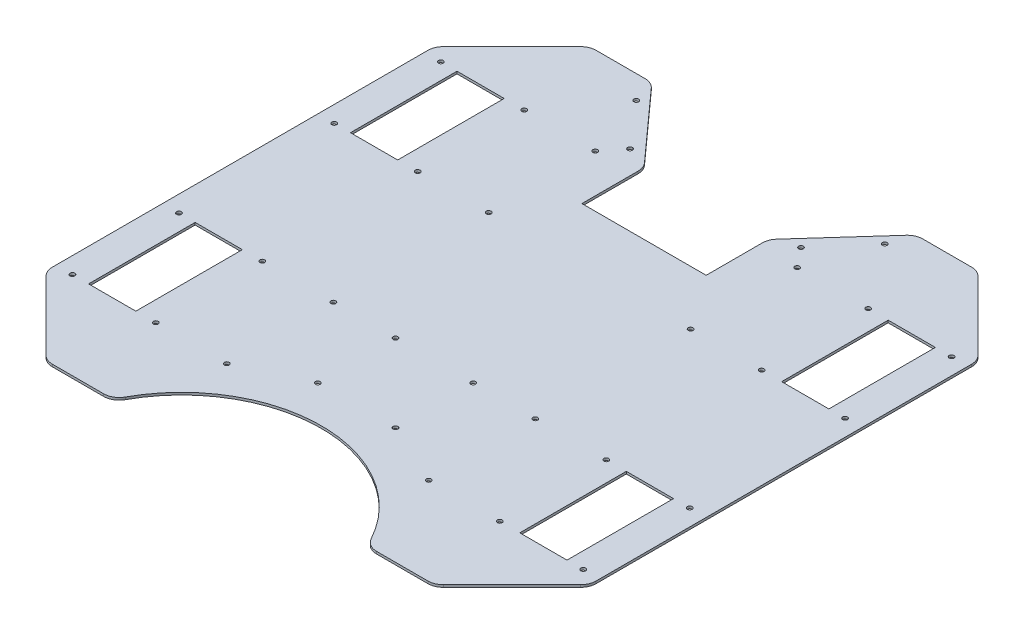
from build123d import *

# Parameters (mm, degrees)
SKETCH_1_R      = 1.55
SKETCH_1_W      = 30.4
SKETCH_1_H      = 68.58
EXTRUDE_1_DEPTH = 1.5
FILLET_1_R      = 10
FILLET_2_R      = 10
FILLET_3_R      = 10


with BuildPart() as part:
    # 草图1 → 凸台-拉伸1 (new body)
    with BuildSketch(Plane(origin=(0, 0, 0), x_dir=(1, 0, 0), z_dir=(0, 1, 0))):
        with BuildLine():
            Line((-125, 175), (-175, 125))
            Line((-175, 125), (-175, -125))
            Line((-175, -125), (-125, -175))
            Line((-125, -175), (-81.710313025, -175))
            ThreePointArc((-81.710313025, -175), (0, -122.728301649), (81.710313025, -175))
            Line((81.710313025, -175), (125, -175))
            Line((125, -175), (175, -125))
            Line((175, -125), (175, 125))
            Line((175, 125), (125, 175))
            Line((125, 175), (85, 175))
            Line((85, 175), (40, 125))
            Line((40, 125), (40, 85))
            Line((40, 85), (-40, 85))
            Line((-40, 85), (-40, 125))
            Line((-40, 125), (-85, 175))
            Line((-85, 175), (-125, 175))
        make_face()
        with Locations((-55, 131)):
            Circle(SKETCH_1_R, mode=Mode.SUBTRACT)
        with Locations((-80, 160)):
            Circle(SKETCH_1_R, mode=Mode.SUBTRACT)
        with Locations((55, 131)):
            Circle(SKETCH_1_R, mode=Mode.SUBTRACT)
        with Locations((80, 160)):
            Circle(SKETCH_1_R, mode=Mode.SUBTRACT)
        with Locations((-65, 118.58)):
            Circle(SKETCH_1_R, mode=Mode.SUBTRACT)
        with Locations((-65, 50)):
            Circle(SKETCH_1_R, mode=Mode.SUBTRACT)
        with Locations((-110.72, 50)):
            Circle(SKETCH_1_R, mode=Mode.SUBTRACT)
        with Locations((-110.72, 118.58)):
            Circle(SKETCH_1_R, mode=Mode.SUBTRACT)
        with Locations((-164.434, 118.58)):
            Circle(SKETCH_1_R, mode=Mode.SUBTRACT)
        with Locations((-164.434, 50)):
            Circle(SKETCH_1_R, mode=Mode.SUBTRACT)
        with Locations((-65, -118.58)):
            Circle(SKETCH_1_R, mode=Mode.SUBTRACT)
        with Locations((-65, -50)):
            Circle(SKETCH_1_R, mode=Mode.SUBTRACT)
        with Locations((-110.72, -50)):
            Circle(SKETCH_1_R, mode=Mode.SUBTRACT)
        with Locations((-110.72, -118.58)):
            Circle(SKETCH_1_R, mode=Mode.SUBTRACT)
        with Locations((-164.434, -50)):
            Circle(SKETCH_1_R, mode=Mode.SUBTRACT)
        with Locations((-164.434, -118.58)):
            Circle(SKETCH_1_R, mode=Mode.SUBTRACT)
        with Locations((65, 50)):
            Circle(SKETCH_1_R, mode=Mode.SUBTRACT)
        with Locations((110.72, 50)):
            Circle(SKETCH_1_R, mode=Mode.SUBTRACT)
        with Locations((110.72, 118.58)):
            Circle(SKETCH_1_R, mode=Mode.SUBTRACT)
        with Locations((65, 118.58)):
            Circle(SKETCH_1_R, mode=Mode.SUBTRACT)
        with Locations((164.434, 118.58)):
            Circle(SKETCH_1_R, mode=Mode.SUBTRACT)
        with Locations((164.434, 50)):
            Circle(SKETCH_1_R, mode=Mode.SUBTRACT)
        with Locations((164.434, -118.58)):
            Circle(SKETCH_1_R, mode=Mode.SUBTRACT)
        with Locations((164.434, -50)):
            Circle(SKETCH_1_R, mode=Mode.SUBTRACT)
        with Locations((110.72, -50)):
            Circle(SKETCH_1_R, mode=Mode.SUBTRACT)
        with Locations((110.72, -118.58)):
            Circle(SKETCH_1_R, mode=Mode.SUBTRACT)
        with Locations((65, -118.58)):
            Circle(SKETCH_1_R, mode=Mode.SUBTRACT)
        with Locations((65, -50)):
            Circle(SKETCH_1_R, mode=Mode.SUBTRACT)
        with Locations((25, -50)):
            Circle(SKETCH_1_R, mode=Mode.SUBTRACT)
        with Locations((25, -100)):
            Circle(SKETCH_1_R, mode=Mode.SUBTRACT)
        with Locations((-25, -50)):
            Circle(SKETCH_1_R, mode=Mode.SUBTRACT)
        with Locations((-25, -100)):
            Circle(SKETCH_1_R, mode=Mode.SUBTRACT)
        with Locations((-138.794, 84.29)):
            Rectangle(SKETCH_1_W, SKETCH_1_H, mode=Mode.SUBTRACT)
        with Locations((138.794, 84.29)):
            Rectangle(SKETCH_1_W, SKETCH_1_H, mode=Mode.SUBTRACT)
        with Locations((-138.794, -84.29)):
            Rectangle(SKETCH_1_W, SKETCH_1_H, mode=Mode.SUBTRACT)
        with Locations((138.794, -84.29)):
            Rectangle(SKETCH_1_W, SKETCH_1_H, mode=Mode.SUBTRACT)
    extrude(amount=EXTRUDE_1_DEPTH)

    # 圆角1
    fillet_1_edges = [part.edges().sort_by_distance(p)[0] for p in [
        (-40, 0.75, -125),
    ]]
    fillet(fillet_1_edges, radius=FILLET_1_R)

    # 圆角2
    fillet_2_edges = [part.edges().sort_by_distance(p)[0] for p in [
        (40, 0.75, -125),
    ]]
    fillet(fillet_2_edges, radius=FILLET_2_R)

    # 圆角3
    fillet_3_edges = [part.edges().sort_by_distance(p)[0] for p in [
        (-85, 0.75, -175),
        (85, 0.75, -175),
        (125, 0.75, -175),
        (175, 0.75, -125),
        (175, 0.75, 125),
        (125, 0.75, 175),
        (81.710313025, 0.75, 175),
        (-81.710313025, 0.75, 175),
        (-125, 0.75, 175),
        (-175, 0.75, 125),
        (-175, 0.75, -125),
        (-125, 0.75, -175),
    ]]
    fillet(fillet_3_edges, radius=FILLET_3_R)


solid = part.part
